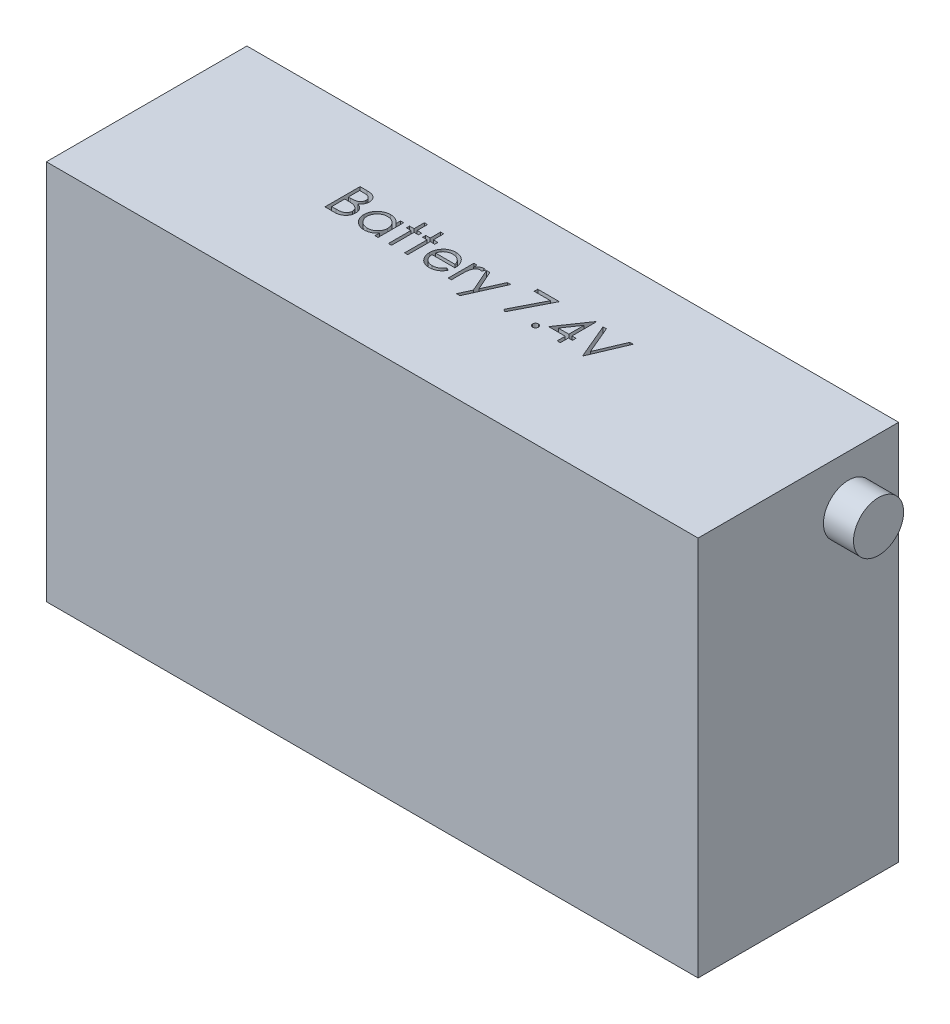
from build123d import *

# Parameters (mm, degrees)
SKETCH_1_W      = 65
SKETCH_1_H      = 38
EXTRUDE_1_DEPTH = 10
WRAP_START      = -3
WRAP_1_DEPTH    = 3
SKETCH_3_R      = 2.5
EXTRUDE_2_DEPTH = 3


# Read off the part's stored shape, not the designer's step: 包覆1
with BuildPart() as part:
    # 草圖1 → 填料-伸長1 (new, symmetric)
    with BuildSketch(Plane.XY):
        Rectangle(SKETCH_1_W, SKETCH_1_H)
    extrude(amount=EXTRUDE_1_DEPTH, both=True)

    # 包覆1 outline → 包覆1 (cut)
    # profile 1 of 11: a face of its own
    with BuildSketch(Plane(origin=(0, 19, 0), x_dir=(1, 0, 0), z_dir=(0, 1, 0)).offset(WRAP_START)):
        with BuildLine():
            add(Edge.make_bspline(
                [(6.331429115, 0.246794872), (6.330233514, 0.227551542), (6.327875807, 0.189603978), (6.312613199, 0.134322516), (6.283715149, 0.084695611), (6.247480156, 0.039393473), (6.202683722, 0.002452603), (6.152581876, -0.024970742), (6.097590618, -0.041662722), (6.059274294, -0.043789019), (6.039762448, -0.044871795)],
                knots=[0, 0, 0, 0, 0.126177718, 0.248820607, 0.371539969, 0.499983707, 0.627244198, 0.749225521, 0.87229795, 1, 1, 1, 1], degree=3))
            add(Edge.make_bspline(
                [(6.039762448, 0.538461538), (6.059252661, 0.537303372), (6.097460943, 0.535032921), (6.152700071, 0.519456248), (6.202694731, 0.491797587), (6.247226976, 0.454934809), (6.283933452, 0.410239146), (6.312577804, 0.360643237), (6.32801879, 0.304941644), (6.330272701, 0.266511969), (6.331429115, 0.246794872)],
                knots=[0, 0, 0, 0, 0.127518927, 0.249985948, 0.371792352, 0.498870353, 0.625948354, 0.748491738, 0.870958759, 1, 1, 1, 1], degree=3))
            add(Edge.make_bspline(
                [(5.748095782, 0.246794872), (5.749157881, 0.266544251), (5.751231499, 0.305102491), (5.76800716, 0.360301599), (5.795383372, 0.410470038), (5.832388767, 0.454866618), (5.876913062, 0.492053921), (5.927209268, 0.519118714), (5.982248808, 0.535159126), (6.020258746, 0.537341643), (6.039762448, 0.538461538)],
                knots=[0, 0, 0, 0, 0.129096958, 0.252045967, 0.373904964, 0.501037835, 0.628170706, 0.751376463, 0.872426013, 1, 1, 1, 1], degree=3))
            add(Edge.make_bspline(
                [(6.039762448, -0.044871795), (6.020236543, -0.043828198), (5.98211686, -0.041790823), (5.927330866, -0.024628016), (5.876923897, 0.002195444), (5.832136186, 0.039462353), (5.795597714, 0.084462497), (5.767972331, 0.134664293), (5.751382182, 0.189445731), (5.74920031, 0.227520373), (5.748095782, 0.246794872)],
                knots=[0, 0, 0, 0, 0.127756603, 0.249414355, 0.372796476, 0.500111333, 0.628609941, 0.750643374, 0.873768379, 1, 1, 1, 1], degree=3))
        make_face()
    # profile 2 of 11: a face of its own
    with BuildSketch(Plane(origin=(0, 19, 0), x_dir=(1, 0, 0), z_dir=(0, 1, 0)).offset(WRAP_START)):
        with BuildLine():
            add(Edge.make_bspline(
                [(-2.104468321, 2.181189904), (-2.081279562, 2.216245732), (-2.036931241, 2.283289731), (-1.963218312, 2.371959032), (-1.887714981, 2.445374079), (-1.810059793, 2.503877598), (-1.729681693, 2.547690717), (-1.648344742, 2.579783752), (-1.564769272, 2.598761067), (-1.508607347, 2.601294726), (-1.480469923, 2.602564103)],
                knots=[0, 0, 0, 0, 0.160059412, 0.306112383, 0.438366514, 0.560541455, 0.675317225, 0.786113634, 0.892841788, 1, 1, 1, 1], degree=3))
            Line((-2.104468321, 2.181189904), (-2.104468321, 2.557692308))
            Line((-2.104468321, 2.557692308), (-2.418570885, 2.557692308))
            Line((-2.418570885, 2.557692308), (-2.418570885, 0))
            Line((-2.418570885, 0), (-2.104468321, 0))
            Line((-2.104468321, 0), (-2.104468321, 0.859575321))
            add(Edge.make_bspline(
                [(-2.048378577, 1.737379808), (-2.053110971, 1.717102634), (-2.063592862, 1.672190235), (-2.0737844, 1.596841711), (-2.083853918, 1.507818052), (-2.090950536, 1.404871459), (-2.097528579, 1.288259015), (-2.101238661, 1.15780307), (-2.104341801, 1.013369718), (-2.104424868, 0.912395365), (-2.104468321, 0.859575321)],
                knots=[0, 0, 0, 0, 0.070854869, 0.15693815, 0.258600395, 0.37589093, 0.508166168, 0.656237809, 0.82017677, 1, 1, 1, 1], degree=3))
            add(Edge.make_bspline(
                [(-1.540065276, 2.288461538), (-1.565271009, 2.286781501), (-1.616683399, 2.283354712), (-1.692167899, 2.256415904), (-1.765415104, 2.212890664), (-1.823586767, 2.164619552), (-1.86862902, 2.118071755), (-1.900769245, 2.077423352), (-1.930251992, 2.031844721), (-1.958422212, 1.982115037), (-1.984088507, 1.927385191), (-2.008043176, 1.868201977), (-2.029702039, 1.804496849), (-2.042052283, 1.760114328), (-2.048378577, 1.737379808)],
                knots=[0, 0, 0, 0, 0.093806529, 0.191338128, 0.295190617, 0.410312337, 0.471930251, 0.536425159, 0.603118728, 0.674117672, 0.749332023, 0.828283384, 0.912039809, 1, 1, 1, 1], degree=3))
            add(Edge.make_bspline(
                [(-1.379508385, 2.242888622), (-1.394617406, 2.249628888), (-1.423297221, 2.262423203), (-1.465251787, 2.277565213), (-1.503933124, 2.286481129), (-1.528576682, 2.287831847), (-1.540065276, 2.288461538)],
                knots=[0, 0, 0, 0, 0.295138801, 0.560229945, 0.794983357, 1, 1, 1, 1], degree=3))
            Line((-1.379508385, 2.242888622), (-1.207032423, 2.514923878))
            add(Edge.make_bspline(
                [(-1.480469923, 2.602564103), (-1.458643597, 2.601373576), (-1.413734512, 2.59892399), (-1.345751922, 2.581713165), (-1.27570847, 2.554235143), (-1.230566083, 2.52839492), (-1.207032423, 2.514923878)],
                knots=[0, 0, 0, 0, 0.225277548, 0.463523195, 0.720323555, 1, 1, 1, 1], degree=3))
        make_face()
    # profile 3 of 11: a face of its own
    with BuildSketch(Plane(origin=(0, 19, 0), x_dir=(1, 0, 0), z_dir=(0, 1, 0)).offset(WRAP_START)):
        with BuildLine():
            add(Edge.make_bspline(
                [(-3.091647808, 0.661157853), (-3.113884403, 0.621714521), (-3.157148012, 0.544973418), (-3.23154876, 0.439541558), (-3.309540832, 0.344693842), (-3.3946448, 0.262964188), (-3.484314479, 0.191712803), (-3.579047134, 0.129374978), (-3.679335952, 0.076256458), (-3.785185676, 0.03150393), (-3.897485228, -0.002905564), (-4.016506744, -0.027209785), (-4.142478239, -0.042233054), (-4.228824419, -0.043978194), (-4.273038032, -0.044871795)],
                knots=[0, 0, 0, 0, 0.093369857, 0.181660766, 0.265874227, 0.346354784, 0.424599862, 0.501903184, 0.579992091, 0.658443431, 0.738672236, 0.821894148, 0.908800792, 1, 1, 1, 1], degree=3))
            Line((-3.091647808, 0.661157853), (-3.370694282, 0.807692308))
            add(Edge.make_bspline(
                [(-4.312300853, 0.269230769), (-4.280949705, 0.269838826), (-4.218743014, 0.271045327), (-4.126102157, 0.282777238), (-4.03496263, 0.301747513), (-3.945701646, 0.327637504), (-3.8601308, 0.359214356), (-3.78088525, 0.397317213), (-3.708005035, 0.43946696), (-3.639888068, 0.487676635), (-3.573817075, 0.546684822), (-3.508274588, 0.620320543), (-3.437997935, 0.707408071), (-3.394008342, 0.772953737), (-3.370694282, 0.807692308)],
                knots=[0, 0, 0, 0, 0.082592263, 0.163878894, 0.24565874, 0.327725695, 0.408609961, 0.485749086, 0.559169056, 0.630268476, 0.705306028, 0.792064966, 0.889796437, 1, 1, 1, 1], degree=3))
            add(Edge.make_bspline(
                [(-5.245493962, 1.211538462), (-5.243954355, 1.177837997), (-5.240926781, 1.111567394), (-5.226811638, 1.01459661), (-5.204562865, 0.922223268), (-5.173293802, 0.835140226), (-5.135426957, 0.752210099), (-5.08904124, 0.674048062), (-5.033701686, 0.601010132), (-4.971975987, 0.532442994), (-4.903268891, 0.471382233), (-4.830986144, 0.416730457), (-4.754092579, 0.37092486), (-4.673194495, 0.33374497), (-4.58842271, 0.304638654), (-4.499750515, 0.284770834), (-4.407352399, 0.271463727), (-4.344366665, 0.269984061), (-4.312300853, 0.269230769)],
                knots=[0, 0, 0, 0, 0.068384615, 0.134475588, 0.198391058, 0.260753477, 0.321829223, 0.383037238, 0.444653123, 0.507398011, 0.569825238, 0.630777641, 0.690928687, 0.750945133, 0.811049477, 0.872330853, 0.935004094, 1, 1, 1, 1], degree=3))
            Line((-5.245493962, 1.211538462), (-2.957032423, 1.211538462))
            add(Edge.make_bspline(
                [(-3.235377776, 2.099158654), (-3.213250838, 2.068955072), (-3.169144245, 2.008748954), (-3.113897145, 1.910577797), (-3.06593975, 1.807867202), (-3.027606789, 1.698956905), (-2.996567287, 1.585137325), (-2.974110469, 1.46559478), (-2.96094085, 1.340364869), (-2.958352153, 1.255038314), (-2.957032423, 1.211538462)],
                knots=[0, 0, 0, 0, 0.11852184, 0.236254763, 0.356174434, 0.477249655, 0.601539871, 0.729618382, 0.862158266, 1, 1, 1, 1], degree=3))
            add(Edge.make_bspline(
                [(-4.265325693, 2.602564103), (-4.212878087, 2.601210054), (-4.109987841, 2.598553718), (-3.95995572, 2.573927385), (-3.817995004, 2.53487483), (-3.684162499, 2.47972104), (-3.558444639, 2.408561488), (-3.441658589, 2.320419647), (-3.331807077, 2.218001559), (-3.267898498, 2.13923835), (-3.235377776, 2.099158654)],
                knots=[0, 0, 0, 0, 0.132040234, 0.259032841, 0.381879824, 0.502258444, 0.62275219, 0.744742632, 0.870108927, 1, 1, 1, 1], degree=3))
            add(Edge.make_bspline(
                [(-5.265125372, 2.125801282), (-5.233417689, 2.163670152), (-5.171006743, 2.238208303), (-5.065450387, 2.336146628), (-4.951150191, 2.418190404), (-4.829538565, 2.48619754), (-4.699202091, 2.537871187), (-4.5618928, 2.576378769), (-4.416047214, 2.59795678), (-4.316341993, 2.601004614), (-4.265325693, 2.602564103)],
                knots=[0, 0, 0, 0, 0.128835254, 0.253589335, 0.374643257, 0.495340042, 0.616324775, 0.739759335, 0.86684232, 1, 1, 1, 1], degree=3))
            add(Edge.make_bspline(
                [(-5.559596526, 1.271834936), (-5.558537385, 1.311129766), (-5.556438306, 1.389006931), (-5.543207519, 1.504272476), (-5.519759226, 1.616300928), (-5.487582902, 1.725185376), (-5.446031656, 1.83074351), (-5.395199437, 1.933039574), (-5.335007059, 2.031964713), (-5.288534385, 2.094367847), (-5.265125372, 2.125801282)],
                knots=[0, 0, 0, 0, 0.128044808, 0.2537679, 0.377428427, 0.500550841, 0.623295883, 0.746578332, 0.872347541, 1, 1, 1, 1], degree=3))
            add(Edge.make_bspline(
                [(-4.273038032, -0.044871795), (-4.32218001, -0.04372462), (-4.418041772, -0.041486813), (-4.557581519, -0.022194348), (-4.688960937, 0.00927801), (-4.81217264, 0.053243552), (-4.926914893, 0.110670876), (-5.033415748, 0.180630358), (-5.132235274, 0.262762612), (-5.220259483, 0.357779056), (-5.299503366, 0.459461013), (-5.369429186, 0.565416898), (-5.427886617, 0.675380122), (-5.475439227, 0.788650646), (-5.513844092, 0.90451454), (-5.540610796, 1.024026007), (-5.556040544, 1.146861592), (-5.558404989, 1.229958927), (-5.559596526, 1.271834936)],
                knots=[0, 0, 0, 0, 0.071578658, 0.139629225, 0.204796697, 0.268134963, 0.329813747, 0.391301398, 0.453433515, 0.51655169, 0.579631271, 0.641118921, 0.701294047, 0.760810336, 0.819931722, 0.878919575, 0.938982822, 1, 1, 1, 1], degree=3))
        make_face()
        with BuildLine():
            add(Edge.make_bspline(
                [(-4.249199891, 2.288461538), (-4.28054933, 2.287849867), (-4.342520579, 2.286640721), (-4.433821647, 2.275170592), (-4.521501346, 2.256210747), (-4.606206634, 2.23024579), (-4.686827502, 2.195637188), (-4.76502227, 2.155053961), (-4.838802666, 2.105512377), (-4.884943962, 2.067753522), (-4.908254379, 2.048677885)],
                knots=[0, 0, 0, 0, 0.131091976, 0.259141276, 0.384161763, 0.505991952, 0.629098089, 0.750669123, 0.874038938, 1, 1, 1, 1], degree=3))
            add(Edge.make_bspline(
                [(-3.271134987, 1.525641026), (-3.282631612, 1.567303899), (-3.304758914, 1.64749152), (-3.350995278, 1.75853241), (-3.403066819, 1.857220311), (-3.46468855, 1.942799944), (-3.534507276, 2.018803457), (-3.615152458, 2.085222043), (-3.705588352, 2.144639494), (-3.805347492, 2.194791993), (-3.910989278, 2.237481852), (-4.02159547, 2.266106968), (-4.134453257, 2.28571651), (-4.210787544, 2.287542618), (-4.249199891, 2.288461538)],
                knots=[0, 0, 0, 0, 0.096240125, 0.185231261, 0.267500523, 0.344400382, 0.419594869, 0.496890627, 0.576637919, 0.660267852, 0.745386615, 0.830040327, 0.914474212, 1, 1, 1, 1], degree=3))
            Line((-3.271134987, 1.525641026), (-5.212541237, 1.525641026))
            add(Edge.make_bspline(
                [(-4.908254379, 2.048677885), (-4.92494766, 2.033583569), (-4.958730795, 2.003036353), (-5.003871316, 1.950407146), (-5.047091789, 1.893655584), (-5.086425442, 1.83061046), (-5.122503028, 1.761989681), (-5.156263005, 1.688372045), (-5.186649417, 1.609198915), (-5.203745527, 1.554026476), (-5.212541237, 1.525641026)],
                knots=[0, 0, 0, 0, 0.109983845, 0.222580497, 0.338499871, 0.458708565, 0.585535346, 0.717517743, 0.85466682, 1, 1, 1, 1], degree=3))
        make_face(mode=Mode.SUBTRACT)
    # profile 4 of 11: a face of its own
    with BuildSketch(Plane(origin=(0, 19, 0), x_dir=(1, 0, 0), z_dir=(0, 1, 0)).offset(WRAP_START)):
        with BuildLine():
            add(Edge.make_bspline(
                [(-9.732673449, 0.442407853), (-9.76809224, 0.402368259), (-9.837212455, 0.324230488), (-9.952653573, 0.222148315), (-10.075021751, 0.137769993), (-10.203723072, 0.069620078), (-10.338641315, 0.018428021), (-10.479477403, -0.017958138), (-10.626288783, -0.041351973), (-10.726541138, -0.043687995), (-10.777344923, -0.044871795)],
                knots=[0, 0, 0, 0, 0.134298379, 0.262084975, 0.386269912, 0.507164597, 0.627300236, 0.748144942, 0.872370177, 1, 1, 1, 1], degree=3))
            Line((-9.732673449, 0.442407853), (-9.732673449, 0))
            Line((-9.732673449, 0), (-9.418570885, 0))
            Line((-9.418570885, 0), (-9.418570885, 2.557692308))
            Line((-9.418570885, 2.557692308), (-9.732673449, 2.557692308))
            Line((-9.732673449, 2.557692308), (-9.732673449, 2.084435096))
            add(Edge.make_bspline(
                [(-10.767529218, 2.602564103), (-10.715329359, 2.601126351), (-10.612967899, 2.598306988), (-10.46323989, 2.574844261), (-10.321595412, 2.535205794), (-10.18694106, 2.481288296), (-10.059760374, 2.409639567), (-9.94125739, 2.319259606), (-9.830191906, 2.210718419), (-9.765811615, 2.127347974), (-9.732673449, 2.084435096)],
                knots=[0, 0, 0, 0, 0.129862142, 0.254653531, 0.376014554, 0.495255252, 0.614797719, 0.738105554, 0.8651963, 1, 1, 1, 1], degree=3))
            add(Edge.make_bspline(
                [(-12.110878577, 1.285857372), (-12.109625606, 1.330321075), (-12.107148549, 1.418223419), (-12.088695329, 1.547502117), (-12.057664321, 1.672020377), (-12.014116473, 1.791377321), (-11.958274518, 1.905717371), (-11.890346431, 2.015121396), (-11.810327306, 2.119890793), (-11.718074899, 2.21756202), (-11.618140129, 2.307782634), (-11.511231398, 2.38619168), (-11.400008117, 2.453908529), (-11.282745106, 2.507562005), (-11.161178001, 2.550971109), (-11.034224556, 2.581004078), (-10.902412977, 2.598701399), (-10.812922485, 2.601264163), (-10.767529218, 2.602564103)],
                knots=[0, 0, 0, 0, 0.063774532, 0.12607881, 0.186904093, 0.247573935, 0.308003356, 0.369131898, 0.432033228, 0.496790794, 0.561610823, 0.624913866, 0.686726349, 0.748078833, 0.809582291, 0.871630743, 0.934885821, 1, 1, 1, 1], degree=3))
            add(Edge.make_bspline(
                [(-10.777344923, -0.044871795), (-10.822512877, -0.043645423), (-10.911586082, -0.041226962), (-11.042615159, -0.022464659), (-11.168707409, 0.007665963), (-11.289981981, 0.049566853), (-11.405654127, 0.105147674), (-11.516714223, 0.171688922), (-11.622586915, 0.250929752), (-11.721658454, 0.341517781), (-11.812890455, 0.439912768), (-11.892951727, 0.544858315), (-11.959704807, 0.655900619), (-12.015524888, 0.771633773), (-12.058521232, 0.892948692), (-12.088494867, 1.01942586), (-12.107235313, 1.150915734), (-12.109652774, 1.240455257), (-12.110878577, 1.285857372)],
                knots=[0, 0, 0, 0, 0.064619991, 0.127433484, 0.189004127, 0.249930071, 0.310668454, 0.372328961, 0.43493911, 0.499575544, 0.564191208, 0.626735217, 0.688109334, 0.749293607, 0.810330528, 0.87190117, 0.935045915, 1, 1, 1, 1], degree=3))
        make_face()
        with BuildLine():
            add(Edge.make_bspline(
                [(-11.796776013, 1.282351763), (-11.79491112, 1.238761656), (-11.791188643, 1.1517523), (-11.764437949, 1.022771723), (-11.719558075, 0.897117681), (-11.658316012, 0.775856687), (-11.581629388, 0.663272587), (-11.492740735, 0.561532464), (-11.390790454, 0.474042876), (-11.277862947, 0.400805303), (-11.157254976, 0.341642782), (-11.030421045, 0.300477142), (-10.899745407, 0.273899362), (-10.810893073, 0.270794885), (-10.766126975, 0.269230769)],
                knots=[0, 0, 0, 0, 0.081589349, 0.162858895, 0.245483689, 0.330807139, 0.416493374, 0.499893203, 0.583048156, 0.667157852, 0.751311929, 0.833784789, 0.916256489, 1, 1, 1, 1], degree=3))
            add(Edge.make_bspline(
                [(-10.763322487, 2.288461538), (-10.809236825, 2.286827901), (-10.899864425, 2.28360336), (-11.032908427, 2.258429865), (-11.160221841, 2.21654527), (-11.281167916, 2.159263369), (-11.393836132, 2.087234632), (-11.494529803, 2.000113249), (-11.584072505, 1.900276235), (-11.659380769, 1.788174125), (-11.720771266, 1.667996033), (-11.763938298, 1.542371595), (-11.792407545, 1.413566618), (-11.795316066, 1.326203932), (-11.796776013, 1.282351763)],
                knots=[0, 0, 0, 0, 0.085920517, 0.169593435, 0.252475515, 0.336244477, 0.419504521, 0.502035907, 0.584774648, 0.669846475, 0.754184866, 0.836658238, 0.918009726, 1, 1, 1, 1], degree=3))
            add(Edge.make_bspline(
                [(-9.732673449, 1.273237179), (-9.733633105, 1.30857501), (-9.735522013, 1.378131043), (-9.749952582, 1.480258561), (-9.772907509, 1.577992287), (-9.805253679, 1.671434976), (-9.847744963, 1.760069991), (-9.898992729, 1.844533752), (-9.959898179, 1.924386963), (-10.029480875, 1.998530034), (-10.105646077, 2.066156496), (-10.186240618, 2.126520737), (-10.272219365, 2.17610951), (-10.362136402, 2.217150781), (-10.456147736, 2.249809931), (-10.555018356, 2.271597625), (-10.657697343, 2.286557946), (-10.727743399, 2.287820327), (-10.763322487, 2.288461538)],
                knots=[0, 0, 0, 0, 0.0656338, 0.129188088, 0.191218683, 0.251912818, 0.312507474, 0.373494434, 0.4351516, 0.498741474, 0.562095217, 0.624186567, 0.685475718, 0.746096815, 0.807611636, 0.869966581, 0.933951019, 1, 1, 1, 1], degree=3))
            add(Edge.make_bspline(
                [(-10.766126975, 0.269230769), (-10.720680472, 0.270890733), (-10.630291885, 0.274192237), (-10.496853178, 0.299473502), (-10.367358215, 0.3412423), (-10.243570986, 0.399141427), (-10.128254855, 0.470898783), (-10.024756978, 0.554905874), (-9.937241009, 0.652609058), (-9.8630484, 0.759985511), (-9.804872983, 0.877697508), (-9.762496924, 1.003031698), (-9.737443018, 1.135992447), (-9.734285288, 1.226856374), (-9.732673449, 1.273237179)],
                knots=[0, 0, 0, 0, 0.084802388, 0.16866354, 0.252551924, 0.338239689, 0.423102661, 0.505556051, 0.586175656, 0.66713572, 0.74849918, 0.830452399, 0.913455706, 1, 1, 1, 1], degree=3))
        make_face(mode=Mode.SUBTRACT)
    # profile 5 of 11: a face of its own
    with BuildSketch(Plane(origin=(0, 19, 0), x_dir=(1, 0, 0), z_dir=(0, 1, 0)).offset(WRAP_START)):
        with BuildLine():
            add(Edge.make_bspline(
                [(-14.030550052, 3.5), (-13.997121573, 3.49982425), (-13.932328863, 3.499483602), (-13.838109421, 3.49420047), (-13.749860611, 3.486996801), (-13.667556838, 3.475566708), (-13.591236136, 3.461774931), (-13.520668499, 3.445073115), (-13.456078326, 3.425046501), (-13.37896559, 3.39320022), (-13.291044929, 3.345877051), (-13.195846536, 3.275948486), (-13.114442297, 3.190416023), (-13.04425598, 3.093933368), (-12.98845486, 2.987797596), (-12.948085563, 2.874538407), (-12.922527687, 2.755616665), (-12.919899253, 2.673973487), (-12.918570885, 2.63271234)],
                knots=[0, 0, 0, 0, 0.062594097, 0.121322939, 0.176680142, 0.228365096, 0.276868446, 0.321879128, 0.364098625, 0.403355696, 0.477967948, 0.550535461, 0.623584457, 0.698174882, 0.77335367, 0.847281125, 0.92281834, 1, 1, 1, 1], degree=3))
            Line((-14.030550052, 3.5), (-14.71344268, 3.5))
            Line((-14.71344268, 3.5), (-14.71344268, 0))
            Line((-14.71344268, 0), (-13.766928257, 0))
            add(Edge.make_bspline(
                [(-12.649340116, 0.993489583), (-12.650316962, 0.959322711), (-12.652238934, 0.892098433), (-12.666418905, 0.793343299), (-12.690428012, 0.698968352), (-12.723499159, 0.608363169), (-12.766661473, 0.521703035), (-12.819189438, 0.438889771), (-12.881821001, 0.36075544), (-12.95188387, 0.286431817), (-13.031146016, 0.21960403), (-13.116661771, 0.160088323), (-13.209508091, 0.111142261), (-13.308160085, 0.070026239), (-13.413724401, 0.038619041), (-13.525727008, 0.016646467), (-13.64407131, 0.00184143), (-13.725281061, 0.000624225), (-13.766928257, 0)],
                knots=[0, 0, 0, 0, 0.061160277, 0.120334558, 0.178180255, 0.235235126, 0.292682961, 0.351186248, 0.41045661, 0.471719854, 0.533761203, 0.595739024, 0.657887515, 0.72129518, 0.786822515, 0.854686154, 0.925477986, 1, 1, 1, 1], degree=3))
            add(Edge.make_bspline(
                [(-13.323118161, 1.888120994), (-13.283357733, 1.872855995), (-13.207286186, 1.84365027), (-13.102600173, 1.792014806), (-13.012405328, 1.735852696), (-12.936008182, 1.674520846), (-12.870670527, 1.608412035), (-12.813617586, 1.536556921), (-12.764936212, 1.458018163), (-12.723223288, 1.373614627), (-12.690674532, 1.284208159), (-12.666298628, 1.190637383), (-12.652331178, 1.093237828), (-12.650343537, 1.026952448), (-12.649340116, 0.993489583)],
                knots=[0, 0, 0, 0, 0.106057493, 0.202914257, 0.290300165, 0.370222566, 0.446383721, 0.5213969, 0.598291083, 0.676142469, 0.7555287, 0.834887172, 0.916646049, 1, 1, 1, 1], degree=3))
            add(Edge.make_bspline(
                [(-12.918570885, 2.63271234), (-12.919664103, 2.594059784), (-12.921812381, 2.518103867), (-12.94235514, 2.407009758), (-12.974515808, 2.301258539), (-13.019221058, 2.201236154), (-13.077323054, 2.10920254), (-13.146181373, 2.024415274), (-13.229258175, 1.950464217), (-13.291501415, 1.909121315), (-13.323118161, 1.888120994)],
                knots=[0, 0, 0, 0, 0.130569107, 0.256580609, 0.380551617, 0.503622917, 0.625739323, 0.747548582, 0.871766119, 1, 1, 1, 1], degree=3))
        make_face()
        with BuildLine():
            add(Edge.make_bspline(
                [(-13.952024411, 0.358974359), (-13.920005485, 0.359358106), (-13.858293226, 0.360097729), (-13.769191996, 0.362512283), (-13.686608892, 0.368004559), (-13.610920756, 0.376650409), (-13.541310304, 0.386028858), (-13.478612601, 0.398640139), (-13.422319407, 0.413089099), (-13.3570451, 0.435423272), (-13.283541591, 0.470119743), (-13.204330735, 0.522433969), (-13.133904517, 0.584757277), (-13.074099258, 0.656888191), (-13.025086269, 0.735319518), (-12.989430814, 0.818464868), (-12.967439957, 0.904950395), (-12.964777788, 0.963917108), (-12.96344268, 0.993489583)],
                knots=[0, 0, 0, 0, 0.072502489, 0.139738989, 0.201795135, 0.259821934, 0.312205989, 0.360773434, 0.404540343, 0.443698099, 0.516840794, 0.587874336, 0.657965418, 0.728969389, 0.79930772, 0.866635778, 0.933116329, 1, 1, 1, 1], degree=3))
            Line((-13.952024411, 0.358974359), (-14.399340116, 0.358974359))
            Line((-14.399340116, 0.358974359), (-14.399340116, 1.66025641))
            Line((-14.399340116, 1.66025641), (-14.191106943, 1.66025641))
            add(Edge.make_bspline(
                [(-13.536259186, 1.618890224), (-13.553288282, 1.622345308), (-13.590210874, 1.629836643), (-13.650418455, 1.637744346), (-13.719154324, 1.644789406), (-13.796577201, 1.650000564), (-13.882785042, 1.655387107), (-13.977961961, 1.657481929), (-14.081719275, 1.659981189), (-14.153711648, 1.660162323), (-14.191106943, 1.66025641)],
                knots=[0, 0, 0, 0, 0.079306486, 0.171952819, 0.277056507, 0.394730576, 0.526177321, 0.671344767, 0.829285257, 1, 1, 1, 1], degree=3))
            add(Edge.make_bspline(
                [(-12.96344268, 0.993489583), (-12.963718784, 1.011982924), (-12.964266539, 1.048671306), (-12.972527154, 1.102587125), (-12.984541024, 1.154812998), (-13.000072458, 1.205490739), (-13.022691925, 1.253704115), (-13.04909847, 1.300406674), (-13.080059872, 1.345660154), (-13.128304037, 1.402872407), (-13.198476022, 1.46878942), (-13.298182797, 1.533326923), (-13.411555095, 1.58537473), (-13.493782588, 1.607474206), (-13.536259186, 1.618890224)],
                knots=[0, 0, 0, 0, 0.060287398, 0.119602355, 0.177503371, 0.235142664, 0.292132593, 0.350871209, 0.410097863, 0.470731522, 0.594828704, 0.722578824, 0.85669139, 1, 1, 1, 1], degree=3))
        make_face(mode=Mode.SUBTRACT)
        with BuildLine():
            add(Edge.make_bspline(
                [(-14.188302455, 2.019230769), (-14.15745366, 2.019630692), (-14.097847501, 2.020403425), (-14.011527604, 2.022616942), (-13.931402586, 2.028814985), (-13.857610753, 2.035011248), (-13.790268309, 2.045085835), (-13.729524448, 2.057077958), (-13.674425851, 2.069760863), (-13.610886305, 2.09133035), (-13.538813357, 2.123208025), (-13.461980252, 2.172679861), (-13.394245783, 2.231604215), (-13.337048595, 2.299595176), (-13.290237125, 2.374461362), (-13.257723409, 2.455008243), (-13.235676125, 2.539228375), (-13.233684594, 2.597046627), (-13.232673449, 2.626402244)],
                knots=[0, 0, 0, 0, 0.072301034, 0.139700332, 0.202288511, 0.260599533, 0.313190329, 0.361738933, 0.405706476, 0.445539985, 0.518831956, 0.58977824, 0.658867479, 0.728430478, 0.797282704, 0.864815377, 0.931363753, 1, 1, 1, 1], degree=3))
            Line((-14.188302455, 2.019230769), (-14.399340116, 2.019230769))
            Line((-14.399340116, 2.019230769), (-14.399340116, 3.141025641))
            Line((-14.399340116, 3.141025641), (-13.973058064, 3.141025641))
            add(Edge.make_bspline(
                [(-13.232673449, 2.626402244), (-13.233199629, 2.645828015), (-13.234231789, 2.683933787), (-13.242685092, 2.739483141), (-13.257052666, 2.791726894), (-13.275506959, 2.841381004), (-13.301295648, 2.886892854), (-13.331659111, 2.92983605), (-13.368344802, 2.968748169), (-13.410102114, 3.005117667), (-13.458110737, 3.037362195), (-13.512342029, 3.065602958), (-13.573529706, 3.088343735), (-13.640642561, 3.108259887), (-13.714713649, 3.122248181), (-13.794888202, 3.133901569), (-13.881822921, 3.139834311), (-13.941968024, 3.140619673), (-13.973058064, 3.141025641)],
                knots=[0, 0, 0, 0, 0.057003133, 0.111817869, 0.164402372, 0.215869805, 0.26684111, 0.317478963, 0.369902136, 0.423400449, 0.479718398, 0.539241497, 0.602430689, 0.671029546, 0.744484798, 0.823453971, 0.908740313, 1, 1, 1, 1], degree=3))
        make_face(mode=Mode.SUBTRACT)
    # profile 6 of 11: a face of its own
    with BuildSketch(Plane(origin=(0, 19, 0), x_dir=(1, 0, 0), z_dir=(0, 1, 0)).offset(WRAP_START)):
        Polygon((12.187198346, 3.5), (11.020531679, 0.741786859), (9.853865013, 3.5), (9.517326551, 3.5), (10.998095782, 0), (11.042967577, 0), (12.523736807, 3.5), align=None)
    # profile 7 of 11: a face of its own
    with BuildSketch(Plane(origin=(0, 19, 0), x_dir=(1, 0, 0), z_dir=(0, 1, 0)).offset(WRAP_START)):
        Polygon((3.325018859, -0.08974359), (5.164762448, 3.5), (3.010916295, 3.5), (3.010916295, 3.141025641), (4.633312128, 3.141025641), (3.053684724, 0.059595353), align=None)
    # profile 8 of 11: a face of its own
    with BuildSketch(Plane(origin=(0, 19, 0), x_dir=(1, 0, 0), z_dir=(0, 1, 0)).offset(WRAP_START)):
        Polygon((8.440403474, 0.807692308), (8.440403474, 0), (8.754506038, 0), (8.754506038, 0.807692308), (9.158352192, 0.807692308), (9.158352192, 1.166666667), (8.754506038, 1.166666667), (8.754506038, 3.58974359), (8.690703955, 3.58974359), (6.780147064, 0.807692308), align=None)
        Polygon((8.440403474, 2.686698718), (8.440403474, 1.166666667), (7.397134243, 1.166666667), align=None, mode=Mode.SUBTRACT)
    # profile 9 of 11: a face of its own
    with BuildSketch(Plane(origin=(0, 19, 0), x_dir=(1, 0, 0), z_dir=(0, 1, 0)).offset(WRAP_START)):
        Polygon((-6.771134987, 2.243589744), (-6.771134987, 0), (-6.457032423, 0), (-6.457032423, 2.243589744), (-6.008314475, 2.243589744), (-6.008314475, 2.557692308), (-6.457032423, 2.557692308), (-6.457032423, 3.58974359), (-6.771134987, 3.58974359), (-6.771134987, 2.557692308), (-7.219852936, 2.557692308), (-7.219852936, 2.243589744), align=None)
    # profile 10 of 11: a face of its own
    with BuildSketch(Plane(origin=(0, 19, 0), x_dir=(1, 0, 0), z_dir=(0, 1, 0)).offset(WRAP_START)):
        Polygon((-8.386519603, 2.243589744), (-8.386519603, 0), (-8.072417039, 0), (-8.072417039, 2.243589744), (-7.62369909, 2.243589744), (-7.62369909, 2.557692308), (-8.072417039, 2.557692308), (-8.072417039, 3.58974359), (-8.386519603, 3.58974359), (-8.386519603, 2.557692308), (-8.835237552, 2.557692308), (-8.835237552, 2.243589744), align=None)
    # profile 11 of 11: a face of its own
    with BuildSketch(Plane(origin=(0, 19, 0), x_dir=(1, 0, 0), z_dir=(0, 1, 0)).offset(WRAP_START)):
        Polygon((0.921573346, 2.557692308), (0.042366615, 0.598758013), (-0.823518802, 2.557692308), (-1.162160629, 2.557692308), (-0.128005981, 0.218048878), (-0.648939475, -0.942307692), (-0.309596526, -0.942307692), (1.260916295, 2.557692308), align=None)
    extrude(amount=WRAP_1_DEPTH, mode=Mode.SUBTRACT)

    # 草圖3 → 填料-伸長2 (add)
    with BuildSketch(Plane(origin=(32.5, 0, 0), x_dir=(0, 0, -1), z_dir=(1, 0, 0))):
        with Locations(Location((5, 14, 0), (0, 0, 270))):
            Circle(SKETCH_3_R)
    extrude(amount=EXTRUDE_2_DEPTH)


solid = part.part
